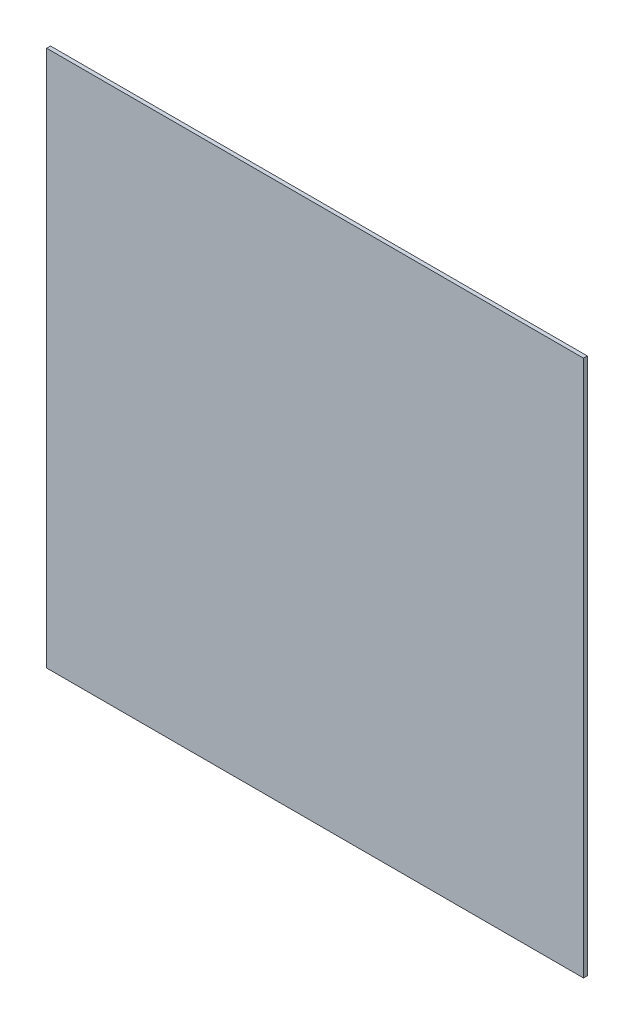
from build123d import *

# Parameters (mm, degrees)
SKETCH1_W           = 17.7292
SKETCH1_H           = 17.7292
BOSS_EXTRUDE1_DEPTH = 0.127


with BuildPart() as part:
    # Sketch1 → Boss-Extrude1 (new body)
    with BuildSketch(Plane.XY):
        with Locations((-88.773, 65.024)):
            Rectangle(SKETCH1_W, SKETCH1_H)
    extrude(amount=BOSS_EXTRUDE1_DEPTH)


solid = part.part
